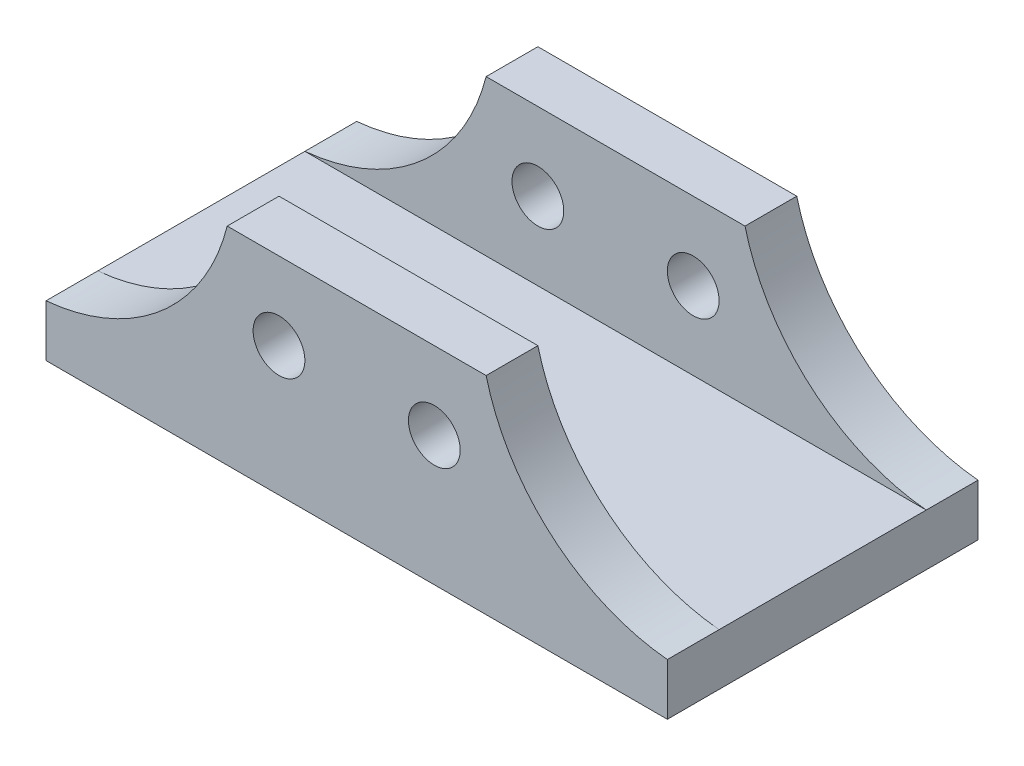
from build123d import *

# Parameters (mm, degrees)
EXTRUDE1_DEPTH     = 12.7
SKETCH2_W          = 152.4
SKETCH2_H          = 12.7
EXTRUDE2_DEPTH     = 25.4
MIRROR1_START      = 38.1
MIRROR1_OUTLINE_W  = 152.4
MIRROR1_OUTLINE_H  = 12.7
MIRROR1_DEPTH      = 38.1
MIRROR1_START_2    = 63.5
MIRROR1_2_DEPTH    = 12.7
SKETCH4_R          = 6.35
CUT_EXTRUDE1_DEPTH = 115.3


# Read off the part's stored shape, not the designer's step: Mirror1
with BuildPart() as part:
    # Sketch1 → Extrude1 (new body)
    with BuildSketch(Plane.XY):
        with BuildLine():
            Line((-31.75, 38.1), (31.75, 38.1))
            ThreePointArc((31.75, 38.1), (47.934687961, 12.002969288), (76.2, 0))
            Line((76.2, 0), (76.2, -12.7))
            Line((76.2, -12.7), (-76.2, -12.7))
            Line((-76.2, -12.7), (-76.2, 0))
            ThreePointArc((-76.2, 0), (-47.934687961, 12.002969288), (-31.75, 38.1))
        make_face()
    extrude(amount=EXTRUDE1_DEPTH)

    # Sketch2 → Extrude2 (add)
    with BuildSketch(Plane.XY.offset(12.7)):
        with Locations((0, -6.35)):
            Rectangle(SKETCH2_W, SKETCH2_H)
    extrude(amount=EXTRUDE2_DEPTH)

    # Mirror1 outline → Mirror1 (add)
    with BuildSketch(Plane.XY.offset(MIRROR1_START)):
        with Locations((0, -6.35)):
            Rectangle(MIRROR1_OUTLINE_W, MIRROR1_OUTLINE_H)
    extrude(amount=MIRROR1_DEPTH)

    # Mirror1 2 outline → Mirror1 2 (add)
    with BuildSketch(Plane.XY.offset(MIRROR1_START_2)):
        with BuildLine():
            ThreePointArc((-31.75, 38.1), (-47.934687961, 12.002969288), (-76.2, 0))
            Line((-76.2, 0), (76.2, 0))
            ThreePointArc((76.2, 0), (47.934687961, 12.002969288), (31.75, 38.1))
            Line((31.75, 38.1), (-31.75, 38.1))
        make_face()
    extrude(amount=MIRROR1_2_DEPTH)

    # Sketch4 → Cut-Extrude1 (cut, through all)
    with BuildSketch(Plane(origin=(0, 0, 0), x_dir=(-1, 0, 0), z_dir=(0, 0, -1))):
        with Locations((-19.05, 19.05)):
            Circle(SKETCH4_R)
        with Locations((19.05, 19.05)):
            Circle(SKETCH4_R)
    extrude(amount=-CUT_EXTRUDE1_DEPTH, mode=Mode.SUBTRACT)


solid = part.part
